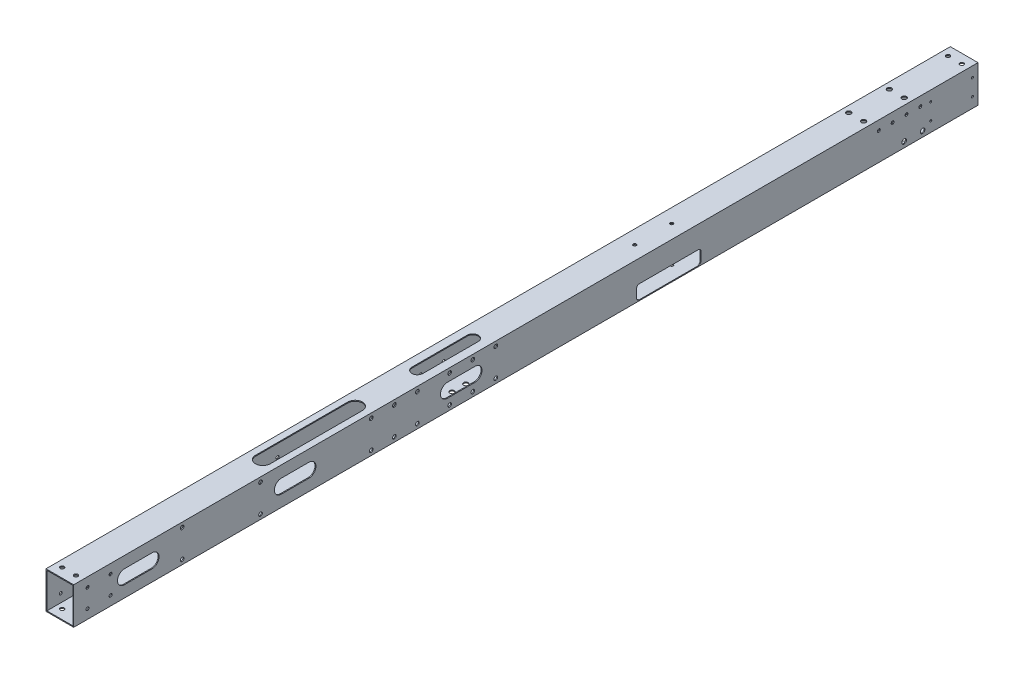
from build123d import *

# Parameters (mm, degrees)
SKETCH_1_W             = 30
SKETCH_1_H             = 40
SKETCH_1_W_2           = 28
SKETCH_1_H_2           = 38
EXTRUDE_1_DEPTH        = 940
SKETCH_5_R             = 2.5
CUT_EXTRUDE_3_DEPTH    = 941.97024395
CUT_EXTRUDE_4_DEPTH    = 1
SKETCH_7_R             = 1.75
CUT_EXTRUDE_5_DEPTH    = 1
SKETCH_17_W            = 30
SKETCH_17_H            = 40
SKETCH_17_W_2          = 28
SKETCH_17_H_2          = 38
EXTRUDE_2_DEPTH        = 20
SKETCH_18_W            = 30
SKETCH_18_H            = 40
SKETCH_18_W_2          = 28
SKETCH_18_H_2          = 38
EXTRUDE_3_DEPTH        = 20
SKETCH_19_R            = 2.1
CUT_EXTRUDE_16_DEPTH   = 961.950050731
SKETCH_20_R            = 1.6
CUT_EXTRUDE_17_DEPTH   = 961.67684473
SKETCH_21_R            = 2.5
SKETCH_21_R_2          = 1.6
CUT_EXTRUDE_18_DEPTH   = 961.67684473
SKETCH_23_R            = 2.5
CUT_EXTRUDE_19_DEPTH   = 961.950050731
SKETCH_24_R            = 4.5
CUT_EXTRUDE_20_DEPTH   = 10
SKETCH_26_R            = 2
CUT_EXTRUDE_22_DEPTH   = 961.67684473
CUT_EXTRUDE_28_DEPTH   = 10
PATTERN_LINEAR_4_COUNT = 2
PATTERN_LINEAR_4_PITCH = 255
PATTERN_LINEAR_8_COUNT = 2
PATTERN_LINEAR_8_PITCH = 205
PATTERN_LINEAR_9_COUNT = 2
PATTERN_LINEAR_9_PITCH = 230
CUT_EXTRUDE_START      = -20
SKETCH_34_R            = 1.75
CUT_EXTRUDE_29_DEPTH   = 20
SKETCH_35_R            = 1.5
CUT_EXTRUDE_30_DEPTH   = 10
CUT_EXTRUDE_31_DEPTH   = 10
SKETCH_37_R            = 1.65
CUT_EXTRUDE_32_DEPTH   = 52
SKETCH_39_R            = 1.75
CUT_EXTRUDE_33_DEPTH   = 10
SKETCH_40_W            = 70
SKETCH_40_H            = 15
CUT_EXTRUDE_34_DEPTH   = 10
EXTRUDE_5_DEPTH        = 1
SKETCH_43_W            = 38.522995696
SKETCH_43_H            = 13.00002022
EXTRUDE_6_DEPTH        = 1
FILLET_1_R             = 3
CUT_EXTRUDE_35_DEPTH   = 10
SKETCH_45_R            = 1.1
CUT_EXTRUDE_36_DEPTH   = 1


with BuildPart() as part:
    # 草图1 → 凸台-拉伸1 (new body)
    with BuildSketch(Plane.XY):
        Rectangle(SKETCH_1_W, SKETCH_1_H)
        Rectangle(SKETCH_1_W_2, SKETCH_1_H_2, mode=Mode.SUBTRACT)
    extrude(amount=EXTRUDE_1_DEPTH)

    # 草图5 → 切除-拉伸3 (cut, through all)
    with BuildSketch(Plane.XZ.offset(20)):
        with Locations((-8, 53)):
            Circle(SKETCH_5_R)
        with Locations((8, 53)):
            Circle(SKETCH_5_R)
        with Locations((-8, 97)):
            Circle(SKETCH_5_R)
        with Locations((8, 97)):
            Circle(SKETCH_5_R)
    extrude(amount=-CUT_EXTRUDE_3_DEPTH, mode=Mode.SUBTRACT)

    # 草图6 → 切除-拉伸4 (cut)
    with BuildSketch(Plane(origin=(15, 0, 0), x_dir=(0, 0, -1), z_dir=(1, 0, 0))):
        with BuildLine():
            Line((-345, -7.5), (-375, -7.5))
            ThreePointArc((-375, -7.5), (-382.5, 0), (-375, 7.5))
            Line((-375, 7.5), (-345, 7.5))
            ThreePointArc((-345, 7.5), (-337.5, 0), (-345, -7.5))
        make_face()
        with BuildLine():
            Line((-525, -7.5), (-555, -7.5))
            ThreePointArc((-555, -7.5), (-562.5, 0), (-555, 7.5))
            Line((-555, 7.5), (-525, 7.5))
            ThreePointArc((-525, 7.5), (-517.5, 0), (-525, -7.5))
        make_face()
        with BuildLine():
            Line((-705, -7.5), (-735, -7.5))
            ThreePointArc((-735, -7.5), (-742.5, 0), (-735, 7.5))
            Line((-735, 7.5), (-705, 7.5))
            ThreePointArc((-705, 7.5), (-697.5, 0), (-705, -7.5))
        make_face()
    extrude(amount=-CUT_EXTRUDE_4_DEPTH, mode=Mode.SUBTRACT)

    # 草图7 → 切除-拉伸5 (cut)
    with BuildSketch(Plane.ZY.offset(15)):
        with Locations((350, 0)):
            Circle(SKETCH_7_R)
        with Locations((375, 0)):
            Circle(SKETCH_7_R)
        with Locations((530, 0)):
            Circle(SKETCH_7_R)
        with Locations((555, 0)):
            Circle(SKETCH_7_R)
        with Locations((710, 0)):
            Circle(SKETCH_7_R)
        with Locations((735, 0)):
            Circle(SKETCH_7_R)
    extrude(amount=-CUT_EXTRUDE_5_DEPTH, mode=Mode.SUBTRACT)

    # 草图17 → 凸台-拉伸2 (add)
    with BuildSketch(Plane.XY.offset(940)):
        Rectangle(SKETCH_17_W, SKETCH_17_H)
        Rectangle(SKETCH_17_W_2, SKETCH_17_H_2, mode=Mode.SUBTRACT)
    extrude(amount=EXTRUDE_2_DEPTH)

    # 草图18 → 凸台-拉伸3 (add)
    with BuildSketch(Plane(origin=(0, 0, 0), x_dir=(-1, 0, 0), z_dir=(0, 0, -1))):
        Rectangle(SKETCH_18_W, SKETCH_18_H)
        Rectangle(SKETCH_18_W_2, SKETCH_18_H_2, mode=Mode.SUBTRACT)
    extrude(amount=EXTRUDE_3_DEPTH)

    # 草图19 → 切除-拉伸16 (cut, through all)
    with BuildSketch(Plane(origin=(0, 20, 0), x_dir=(1, 0, 0), z_dir=(0, 1, 0))):
        with Locations((-7.5, -950)):
            Circle(SKETCH_19_R)
        with Locations((7.5, -950)):
            Circle(SKETCH_19_R)
        with Locations((-7.5, 10)):
            Circle(SKETCH_19_R)
        with Locations((7.5, 10)):
            Circle(SKETCH_19_R)
    extrude(amount=-CUT_EXTRUDE_16_DEPTH, mode=Mode.SUBTRACT)

    # 草图20 → 切除-拉伸17 (cut, through all)
    with BuildSketch(Plane(origin=(15, 0, 0), x_dir=(0, 0, -1), z_dir=(1, 0, 0))):
        with Locations((-945, 10)):
            Circle(SKETCH_20_R)
        with Locations((-920, 10)):
            Circle(SKETCH_20_R)
        with Locations((-920, -10)):
            Circle(SKETCH_20_R)
        with Locations((-945, -10)):
            Circle(SKETCH_20_R)
    extrude(amount=-CUT_EXTRUDE_17_DEPTH, mode=Mode.SUBTRACT)

    # 草图21 → 切除-拉伸18 (cut, through all)
    with BuildSketch(Plane(origin=(15, 0, 0), x_dir=(0, 0, -1), z_dir=(1, 0, 0))):
        with Locations((-40, -14)):
            Circle(SKETCH_21_R)
        with Locations((-60, -14)):
            Circle(SKETCH_21_R)
        with Locations((-42.5, 10)):
            Circle(SKETCH_21_R_2)
        with Locations((-57.5, 10)):
            Circle(SKETCH_21_R_2)
        with Locations((-72.5, 10)):
            Circle(SKETCH_21_R_2)
        with Locations((-87.5, 10)):
            Circle(SKETCH_21_R_2)
    extrude(amount=-CUT_EXTRUDE_18_DEPTH, mode=Mode.SUBTRACT)

    # 草图23 → 切除-拉伸19 (cut, through all)
    with BuildSketch(Plane(origin=(0, 20, 0), x_dir=(1, 0, 0), z_dir=(0, 1, 0))):
        with Locations((0, -520)):
            Circle(SKETCH_23_R)
        with Locations((0, -535)):
            Circle(SKETCH_23_R)
        with Locations((0, -550)):
            Circle(SKETCH_23_R)
        with Locations((0, -565)):
            Circle(SKETCH_23_R)
    extrude(amount=-CUT_EXTRUDE_19_DEPTH, mode=Mode.SUBTRACT)

    # 草图24 → 切除-拉伸20 (cut)
    with BuildSketch(Plane(origin=(0, 20, 0), x_dir=(1, 0, 0), z_dir=(0, 1, 0))):
        with Locations((0, -520)):
            Circle(SKETCH_24_R)
        with Locations((0, -535)):
            Circle(SKETCH_24_R)
        with Locations((0, -550)):
            Circle(SKETCH_24_R)
        with Locations((0, -565)):
            Circle(SKETCH_24_R)
    extrude(amount=-CUT_EXTRUDE_20_DEPTH, mode=Mode.SUBTRACT)

    # 草图26 → 切除-拉伸22 (cut, through all)
    with BuildSketch(Plane(origin=(15, 0, 0), x_dir=(0, 0, -1), z_dir=(1, 0, 0))):
        with Locations((-842.5, 15)):
            Circle(SKETCH_26_R)
        with Locations((-842.5, -15)):
            Circle(SKETCH_26_R)
        with Locations((-757.5, -15)):
            Circle(SKETCH_26_R)
        with Locations((-757.5, 15)):
            Circle(SKETCH_26_R)
    cut_extrude_22 = extrude(amount=-CUT_EXTRUDE_22_DEPTH, mode=Mode.SUBTRACT)

    # 草图33 → 切除-拉伸28 (cut)
    with BuildSketch(Plane(origin=(0, 20, 0), x_dir=(1, 0, 0), z_dir=(0, 1, 0))):
        with BuildLine():
            Line((6, -512.5), (6, -572.5))
            ThreePointArc((6, -572.5), (0, -578.5), (-6, -572.5))
            Line((-6, -572.5), (-6, -512.5))
            ThreePointArc((-6, -512.5), (0, -506.5), (6, -512.5))
        make_face()
    extrude(amount=-CUT_EXTRUDE_28_DEPTH, mode=Mode.SUBTRACT)

    # 阵列(线性)4: 切除-拉伸22 ×2
    with Locations(*[(0, 0, -i * PATTERN_LINEAR_4_PITCH) for i in range(1, PATTERN_LINEAR_4_COUNT)]):
        add(cut_extrude_22, mode=Mode.SUBTRACT)

    # 阵列(线性)8: 切除-拉伸22 ×2
    with Locations(*[(0, 0, -i * PATTERN_LINEAR_8_PITCH) for i in range(1, PATTERN_LINEAR_8_COUNT)]):
        add(cut_extrude_22, mode=Mode.SUBTRACT)

    # 阵列(线性)9: 切除-拉伸22 ×2
    with Locations(*[(0, 0, -i * PATTERN_LINEAR_9_PITCH) for i in range(1, PATTERN_LINEAR_9_COUNT)]):
        add(cut_extrude_22, mode=Mode.SUBTRACT)

    # 草图34 → 切除-拉伸29 (cut)
    with BuildSketch(Plane(origin=(15, 0, 0), x_dir=(0, 0, -1), z_dir=(1, 0, 0)).offset(CUT_EXTRUDE_START)):
        with Locations((-905, 0)):
            Circle(SKETCH_34_R)
        with Locations((-880, 0)):
            Circle(SKETCH_34_R)
    extrude(amount=-CUT_EXTRUDE_29_DEPTH, mode=Mode.SUBTRACT)

    # 草图35 → 切除-拉伸30 (cut)
    with BuildSketch(Plane.XZ.offset(20)):
        with Locations((5, 720)):
            Circle(SKETCH_35_R)
        with Locations((5, 700)):
            Circle(SKETCH_35_R)
        with Locations((5, 680)):
            Circle(SKETCH_35_R)
        with Locations((5, 660)):
            Circle(SKETCH_35_R)
        with Locations((5, 640)):
            Circle(SKETCH_35_R)
        with Locations((5, 740)):
            Circle(SKETCH_35_R)
    extrude(amount=-CUT_EXTRUDE_30_DEPTH, mode=Mode.SUBTRACT)

    # 草图36 → 切除-拉伸31 (cut)
    with BuildSketch(Plane(origin=(0, 20, 0), x_dir=(1, 0, 0), z_dir=(0, 1, 0))):
        with BuildLine():
            Line((8, -640), (8, -740))
            ThreePointArc((8, -740), (0, -748), (-8, -740))
            Line((-8, -740), (-8, -640))
            ThreePointArc((-8, -640), (0, -632), (8, -640))
        make_face()
    extrude(amount=-CUT_EXTRUDE_31_DEPTH, mode=Mode.SUBTRACT)

    # 草图37 → 切除-拉伸32 (cut)
    with BuildSketch(Plane(origin=(0, 20, 0), x_dir=(1, 0, 0), z_dir=(0, 1, 0))):
        with Locations((0, -297)):
            Circle(SKETCH_37_R)
        with Locations((0, -337)):
            Circle(SKETCH_37_R)
    extrude(amount=-CUT_EXTRUDE_32_DEPTH, mode=Mode.SUBTRACT)

    # 草图39 → 切除-拉伸33 (cut)
    with BuildSketch(Plane.XZ.offset(20)):
        with Locations((0, 137)):
            Circle(SKETCH_39_R)
        with Locations((0, 177)):
            Circle(SKETCH_39_R)
    extrude(amount=-CUT_EXTRUDE_33_DEPTH, mode=Mode.SUBTRACT)

    # 草图40 → 切除-拉伸34 (cut)
    with BuildSketch(Plane(origin=(15, 0, 0), x_dir=(0, 0, -1), z_dir=(1, 0, 0))):
        with Locations((-315, -11.5)):
            Rectangle(SKETCH_40_W, SKETCH_40_H)
    extrude(amount=-CUT_EXTRUDE_34_DEPTH, mode=Mode.SUBTRACT)

    # 草图42 → 凸台-拉伸5 (add)
    with BuildSketch(Plane(origin=(15, 0, 0), x_dir=(0, 0, -1), z_dir=(1, 0, 0))):
        Polygon((-350, -8.24794841), (-350, -4), (-334.23295051, -4), (-334.23295051, 12.222841732), (-383.610977641, 12.222841732), (-383.610977641, -8.24794841), align=None)
    extrude(amount=-EXTRUDE_5_DEPTH)

    # 草图43 → 凸台-拉伸6 (add)
    with BuildSketch(Plane.ZY.offset(15)):
        with Locations((362.400416305, 1.435266839)):
            Rectangle(SKETCH_43_W, SKETCH_43_H)
    extrude(amount=-EXTRUDE_6_DEPTH)

    # 圆角1
    fillet_1_edges = [part.edges().sort_by_distance(p)[0] for p in [
        (14.5, -19, 280),
        (14.5, -4, 280),
        (14.5, -19, 350),
        (14.5, -4, 350),
    ]]
    fillet(fillet_1_edges, radius=FILLET_1_R)

    # 草图44 → 切除-拉伸35 (cut)
    with BuildSketch(Plane(origin=(15, 0, 0), x_dir=(0, 0, -1), z_dir=(1, 0, 0))):
        with BuildLine():
            ThreePointArc((-875, -7.5), (-867.5, 0), (-875, 7.5))
            Line((-875, 7.5), (-905, 7.5))
            ThreePointArc((-905, 7.5), (-912.5, 0), (-905, -7.5))
            Line((-905, -7.5), (-875, -7.5))
        make_face()
    extrude(amount=-CUT_EXTRUDE_35_DEPTH, mode=Mode.SUBTRACT)

    # 草图45 → 切除-拉伸36 (cut)
    with BuildSketch(Plane(origin=(15, 0, 0), x_dir=(0, 0, -1), z_dir=(1, 0, 0))):
        with Locations((-31.199995376, 9.020444537)):
            Circle(SKETCH_45_R)
        with Locations((14, 9)):
            Circle(SKETCH_45_R)
        with Locations((14, -9)):
            Circle(SKETCH_45_R)
        with Locations((-31.199995376, -9.020444537)):
            Circle(SKETCH_45_R)
    extrude(amount=-CUT_EXTRUDE_36_DEPTH, mode=Mode.SUBTRACT)


solid = part.part
